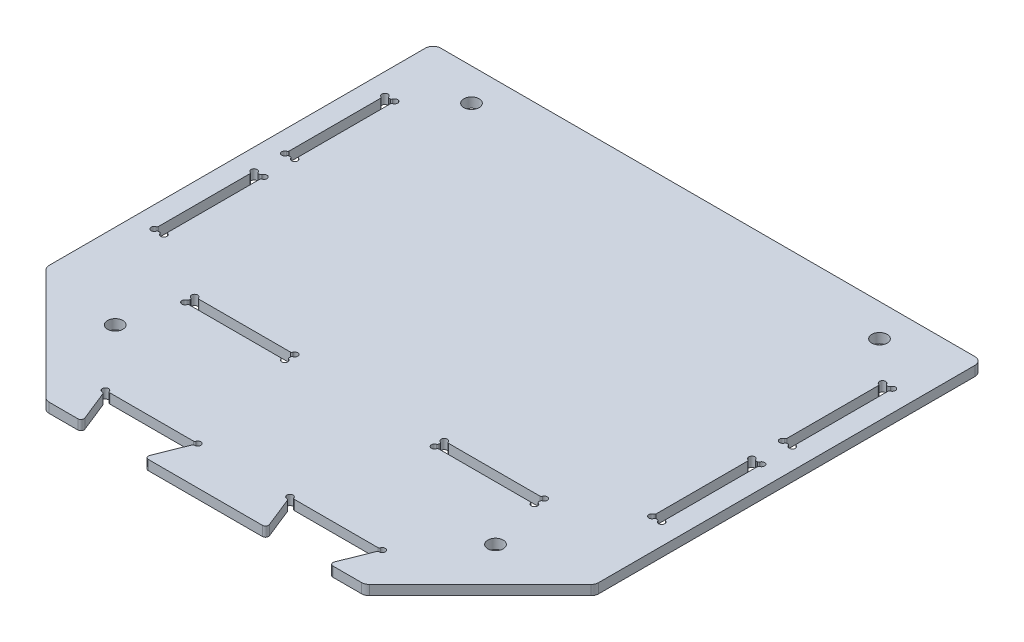
from build123d import *

# Parameters (mm, degrees)
SKETCH1_W              = 357.3
SKETCH1_H              = 326.68
BOSS_EXTRUDE1_DEPTH    = 6.35
CUT_EXTRUDE3_DEPTH     = 6.35
SKETCH7_R              = 2
CUT_EXTRUDE6_DEPTH     = 6.35
FILLET4_R              = 2
FILLET5_R              = 1
CHAMFER1_SIZE          = 75
FILLET3_R              = 5
SKETCH8_W              = 6.35
SKETCH8_H              = 65
CUT_EXTRUDE7_DEPTH     = 6.35
SKETCH9_R              = 2
CUT_EXTRUDE8_DEPTH     = 6.35
FILLET6_R              = 1
LPATTERN2_COUNT        = 2
LPATTERN2_PITCH        = 85
FILLET6_OF_LPATTERN2_R = 1
MIRROR1_DEPTH          = 6.35
SKETCH10_W             = 65
SKETCH10_H             = 6.35
CUT_EXTRUDE9_DEPTH     = 6.35
SKETCH11_R             = 2
CUT_EXTRUDE10_DEPTH    = 6.35
FILLET7_R              = 1
FILLET7_OF_MIRROR2_R   = 1
SKETCH12_R             = 5
CUT_EXTRUDE11_DEPTH    = 6.35


# Read off the part's stored shape, not the designer's step: Mirror1
with BuildPart() as part:
    # Sketch1 → Boss-Extrude1 (new body)
    with BuildSketch(Plane(origin=(0, 0, 0), x_dir=(1, 0, 0), z_dir=(0, 1, 0))):
        Rectangle(SKETCH1_W, SKETCH1_H)
    extrude(amount=BOSS_EXTRUDE1_DEPTH)

    # Sketch4 → Cut-Extrude3 (cut)
    with BuildSketch(Plane(origin=(0, 6.35, 0), x_dir=(1, 0, 0), z_dir=(0, 1, 0))):
        Polygon((-80, -163.34), (-90, -138.34), (-30, -138.34), (-40, -163.34), align=None)
        Polygon((40, -163.34), (30, -138.34), (90, -138.34), (80, -163.34), align=None)
    extrude(amount=-CUT_EXTRUDE3_DEPTH, mode=Mode.SUBTRACT)

    # Sketch7 → Cut-Extrude6 (cut)
    with BuildSketch(Plane(origin=(0, 6.35, 0), x_dir=(1, 0, 0), z_dir=(0, 1, 0))):
        with Locations((-90, -138.34)):
            Circle(SKETCH7_R)
        with Locations((-30, -138.34)):
            Circle(SKETCH7_R)
        with Locations((30, -138.34)):
            Circle(SKETCH7_R)
        with Locations((90, -138.34)):
            Circle(SKETCH7_R)
    extrude(amount=-CUT_EXTRUDE6_DEPTH, mode=Mode.SUBTRACT)

    # Fillet4
    fillet4_edges = [part.edges().sort_by_distance(p)[0] for p in [
        (-40, 3.175, 163.34),
        (-80, 3.175, 163.34),
        (80, 3.175, 163.34),
        (40, 3.175, 163.34),
    ]]
    fillet(fillet4_edges, radius=FILLET4_R)

    # Fillet5
    fillet5_edges = [part.edges().sort_by_distance(p)[0] for p in [
        (-30.742781353, 3.175, 140.196953382),
        (-88, 3.175, 138.34),
        (89.257218647, 3.175, 140.196953382),
        (32, 3.175, 138.34),
        (-89.257218647, 3.175, 140.196953382),
        (-32, 3.175, 138.34),
        (30.742781353, 3.175, 140.196953382),
        (88, 3.175, 138.34),
    ]]
    fillet(fillet5_edges, radius=FILLET5_R)

    # Chamfer1
    chamfer1_edges = [part.edges().sort_by_distance(p)[0] for p in [
        (178.65, 3.175, 163.34),
        (-178.65, 3.175, 163.34),
    ]]
    chamfer(chamfer1_edges, length=CHAMFER1_SIZE)

    # Fillet3
    fillet3_edges = [part.edges().sort_by_distance(p)[0] for p in [
        (-103.65, 3.175, 163.34),
        (-178.65, 3.175, 88.34),
        (178.65, 3.175, 88.34),
        (103.65, 3.175, 163.34),
        (-178.65, 3.175, -163.34),
        (178.65, 3.175, -163.34),
    ]]
    fillet(fillet3_edges, radius=FILLET3_R)

    # Sketch8 → Cut-Extrude7 (cut)
    with BuildSketch(Plane(origin=(0, 6.35, 0), x_dir=(1, 0, 0), z_dir=(0, 1, 0))):
        with Locations((161.825, 85.84)):
            Rectangle(SKETCH8_W, SKETCH8_H)
    cut_extrude7 = extrude(amount=-CUT_EXTRUDE7_DEPTH, mode=Mode.SUBTRACT)

    # Sketch9 → Cut-Extrude8 (cut)
    with BuildSketch(Plane(origin=(0, 6.35, 0), x_dir=(1, 0, 0), z_dir=(0, 1, 0))):
        with Locations((158.65, 118.34)):
            Circle(SKETCH9_R)
        with Locations((165, 118.34)):
            Circle(SKETCH9_R)
        with Locations((158.65, 53.34)):
            Circle(SKETCH9_R)
        with Locations((165, 53.34)):
            Circle(SKETCH9_R)
    cut_extrude8 = extrude(amount=-CUT_EXTRUDE8_DEPTH, mode=Mode.SUBTRACT)

    # Fillet6
    fillet6_edges = [part.edges().sort_by_distance(p)[0] for p in [
        (163, 3.175, -53.34),
        (160.65, 3.175, -53.34),
        (165, 3.175, -116.34),
        (160.65, 3.175, -118.34),
        (163, 3.175, -118.34),
        (158.65, 3.175, -55.34),
        (165, 3.175, -55.34),
        (158.65, 3.175, -116.34),
    ]]
    fillet(fillet6_edges, radius=FILLET6_R)

    # LPattern2: Cut-Extrude7, Cut-Extrude8 ×2
    with Locations(*[(0, 0, i * LPATTERN2_PITCH) for i in range(1, LPATTERN2_COUNT)]):
        add(cut_extrude7, mode=Mode.SUBTRACT)
        add(cut_extrude8, mode=Mode.SUBTRACT)

    # Fillet6 of LPattern2
    fillet6_of_lpattern2_edges = [part.edges().sort_by_distance(p)[0] for p in [
        (163, 3.175, 31.66),
        (160.65, 3.175, 31.66),
        (165, 3.175, -31.34),
        (160.65, 3.175, -33.34),
        (163, 3.175, -33.34),
        (158.65, 3.175, 29.66),
        (165, 3.175, 29.66),
        (158.65, 3.175, -31.34),
    ]]
    fillet(fillet6_of_lpattern2_edges, radius=FILLET6_OF_LPATTERN2_R)

    # Mirror1 outline → Mirror1 (cut)
    with BuildSketch(Plane(origin=(0, 0, 0), x_dir=(1, 0, 0), z_dir=(0, 1, 0))):
        with BuildLine():
            Line((-161.478427125, 33.34), (-162.171572875, 33.34))
            ThreePointArc((-162.171572875, 33.34), (-162.748923144, 33.523503419), (-163.114381917, 34.006666667))
            ThreePointArc((-163.114381917, 34.006666667), (-166.414213562, 34.754213562), (-165.666666667, 31.454381917))
            ThreePointArc((-165.666666667, 31.454381917), (-165.183503419, 31.088923144), (-165, 30.511572875))
            Line((-165, 30.511572875), (-165, -28.831572875))
            ThreePointArc((-165, -28.831572875), (-165.183503419, -29.408923144), (-165.666666667, -29.774381917))
            ThreePointArc((-165.666666667, -29.774381917), (-166.414213562, -33.074213562), (-163.114381917, -32.326666667))
            ThreePointArc((-163.114381917, -32.326666667), (-162.748923144, -31.843503419), (-162.171572875, -31.66))
            Line((-162.171572875, -31.66), (-161.478427125, -31.66))
            ThreePointArc((-161.478427125, -31.66), (-160.901076856, -31.843503419), (-160.535618083, -32.326666667))
            ThreePointArc((-160.535618083, -32.326666667), (-157.235786438, -33.074213562), (-157.983333333, -29.774381917))
            ThreePointArc((-157.983333333, -29.774381917), (-158.466496581, -29.408923144), (-158.65, -28.831572875))
            Line((-158.65, -28.831572875), (-158.65, 30.511572875))
            ThreePointArc((-158.65, 30.511572875), (-158.466496581, 31.088923144), (-157.983333333, 31.454381917))
            ThreePointArc((-157.983333333, 31.454381917), (-157.235786438, 34.754213562), (-160.535618083, 34.006666667))
            ThreePointArc((-160.535618083, 34.006666667), (-160.901076856, 33.523503419), (-161.478427125, 33.34))
        make_face()
        with BuildLine():
            Line((-165, 115.511572875), (-165, 56.168427125))
            ThreePointArc((-165, 56.168427125), (-165.183503419, 55.591076856), (-165.666666667, 55.225618083))
            ThreePointArc((-165.666666667, 55.225618083), (-166.414213562, 51.925786438), (-163.114381917, 52.673333333))
            ThreePointArc((-163.114381917, 52.673333333), (-162.748923144, 53.156496581), (-162.171572875, 53.34))
            Line((-162.171572875, 53.34), (-161.478427125, 53.34))
            ThreePointArc((-161.478427125, 53.34), (-160.901076856, 53.156496581), (-160.535618083, 52.673333333))
            ThreePointArc((-160.535618083, 52.673333333), (-157.235786438, 51.925786438), (-157.983333333, 55.225618083))
            ThreePointArc((-157.983333333, 55.225618083), (-158.466496581, 55.591076856), (-158.65, 56.168427125))
            Line((-158.65, 56.168427125), (-158.65, 115.511572875))
            ThreePointArc((-158.65, 115.511572875), (-158.466496581, 116.088923144), (-157.983333333, 116.454381917))
            ThreePointArc((-157.983333333, 116.454381917), (-157.235786438, 119.754213562), (-160.535618083, 119.006666667))
            ThreePointArc((-160.535618083, 119.006666667), (-160.901076856, 118.523503419), (-161.478427125, 118.34))
            Line((-161.478427125, 118.34), (-162.171572875, 118.34))
            ThreePointArc((-162.171572875, 118.34), (-162.748923144, 118.523503419), (-163.114381917, 119.006666667))
            ThreePointArc((-163.114381917, 119.006666667), (-166.414213562, 119.754213562), (-165.666666667, 116.454381917))
            ThreePointArc((-165.666666667, 116.454381917), (-165.183503419, 116.088923144), (-165, 115.511572875))
        make_face()
    extrude(amount=MIRROR1_DEPTH, mode=Mode.SUBTRACT)

    # Sketch10 → Cut-Extrude9 (cut)
    with BuildSketch(Plane(origin=(0, 6.35, 0), x_dir=(1, 0, 0), z_dir=(0, 1, 0))):
        with Locations((81.15, -59.835)):
            Rectangle(SKETCH10_W, SKETCH10_H)
    cut_extrude9 = extrude(amount=-CUT_EXTRUDE9_DEPTH, mode=Mode.SUBTRACT)

    # Sketch11 → Cut-Extrude10 (cut)
    with BuildSketch(Plane(origin=(0, 6.35, 0), x_dir=(1, 0, 0), z_dir=(0, 1, 0))):
        with Locations((48.65, -56.66)):
            Circle(SKETCH11_R)
        with Locations((48.65, -63.01)):
            Circle(SKETCH11_R)
        with Locations((113.65, -56.66)):
            Circle(SKETCH11_R)
        with Locations((113.65, -63.01)):
            Circle(SKETCH11_R)
    cut_extrude10 = extrude(amount=-CUT_EXTRUDE10_DEPTH, mode=Mode.SUBTRACT)

    # Fillet7
    fillet7_edges = [part.edges().sort_by_distance(p)[0] for p in [
        (111.65, 3.175, 63.01),
        (50.65, 3.175, 63.01),
        (113.65, 3.175, 58.66),
        (50.65, 3.175, 56.66),
        (48.65, 3.175, 61.01),
        (111.65, 3.175, 56.66),
        (113.65, 3.175, 61.01),
        (48.65, 3.175, 58.66),
    ]]
    fillet(fillet7_edges, radius=FILLET7_R)

    # Mirror2: Cut-Extrude9, Cut-Extrude10 across plane
    add(cut_extrude9.mirror(Plane(origin=(0, 0, 0), x_dir=(0, 0, 1), z_dir=(1, 0, 0))), mode=Mode.SUBTRACT)
    add(cut_extrude10.mirror(Plane(origin=(0, 0, 0), x_dir=(0, 0, 1), z_dir=(1, 0, 0))), mode=Mode.SUBTRACT)

    # Fillet7 of Mirror2
    fillet7_of_mirror2_edges = [part.edges().sort_by_distance(p)[0] for p in [
        (-111.65, 3.175, 63.01),
        (-50.65, 3.175, 63.01),
        (-113.65, 3.175, 58.66),
        (-50.65, 3.175, 56.66),
        (-48.65, 3.175, 61.01),
        (-111.65, 3.175, 56.66),
        (-113.65, 3.175, 61.01),
        (-48.65, 3.175, 58.66),
    ]]
    fillet(fillet7_of_mirror2_edges, radius=FILLET7_OF_MIRROR2_R)

    # Sketch12 → Cut-Extrude11 (cut)
    with BuildSketch(Plane(origin=(0, 6.35, 0), x_dir=(1, 0, 0), z_dir=(0, 1, 0))):
        with Locations(Location((-132.65, 142.34, 0), (0, 0, 270))):
            Circle(SKETCH12_R)
        with Locations(Location((132.65, 142.34, 0), (0, 0, 270))):
            Circle(SKETCH12_R)
        with Locations(Location((123.65, -98.34, 0), (0, 0, 270))):
            Circle(SKETCH12_R)
        with Locations(Location((-123.65, -98.34, 0), (0, 0, 270))):
            Circle(SKETCH12_R)
    extrude(amount=-CUT_EXTRUDE11_DEPTH, mode=Mode.SUBTRACT)


solid = part.part
